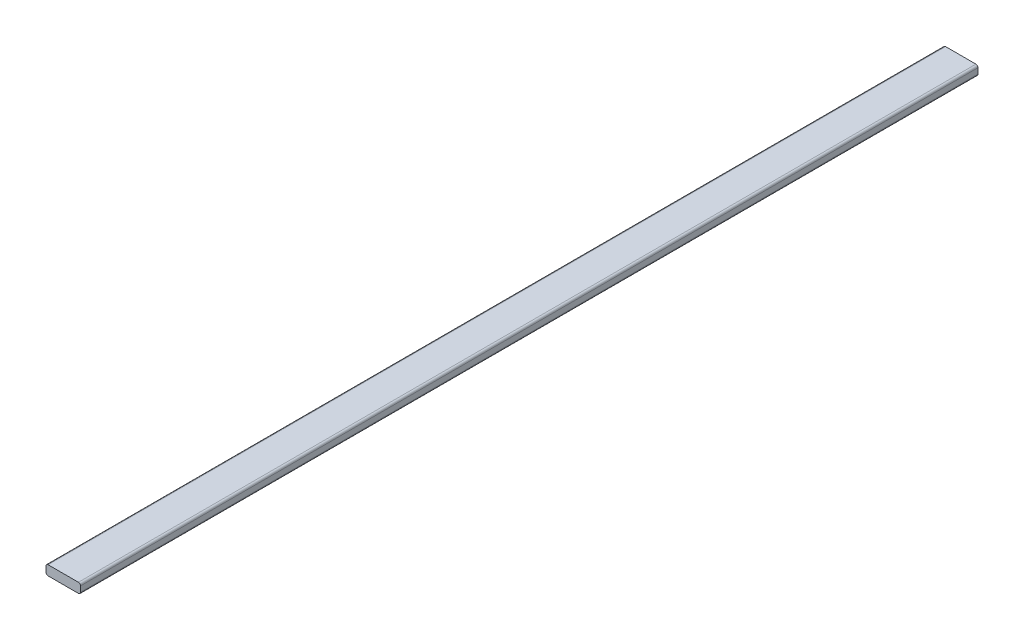
from build123d import *

# Parameters (mm, degrees)
SKETCH2_W           = 12.7
SKETCH2_H           = 3.556
BOSS_EXTRUDE1_DEPTH = 330.2
FILLET1_R           = 0.762


with BuildPart() as part:
    # Sketch2 → Boss-Extrude1 (new body)
    with BuildSketch(Plane.XY):
        with Locations((6.35, 1.778)):
            Rectangle(SKETCH2_W, SKETCH2_H)
    extrude(amount=BOSS_EXTRUDE1_DEPTH)

    # Fillet1
    fillet1_edges = [part.edges().sort_by_distance(p)[0] for p in [
        (12.7, 3.556, 165.1),
        (12.7, 0, 165.1),
        (0, 0, 165.1),
        (0, 3.556, 165.1),
    ]]
    fillet(fillet1_edges, radius=FILLET1_R)


solid = part.part
